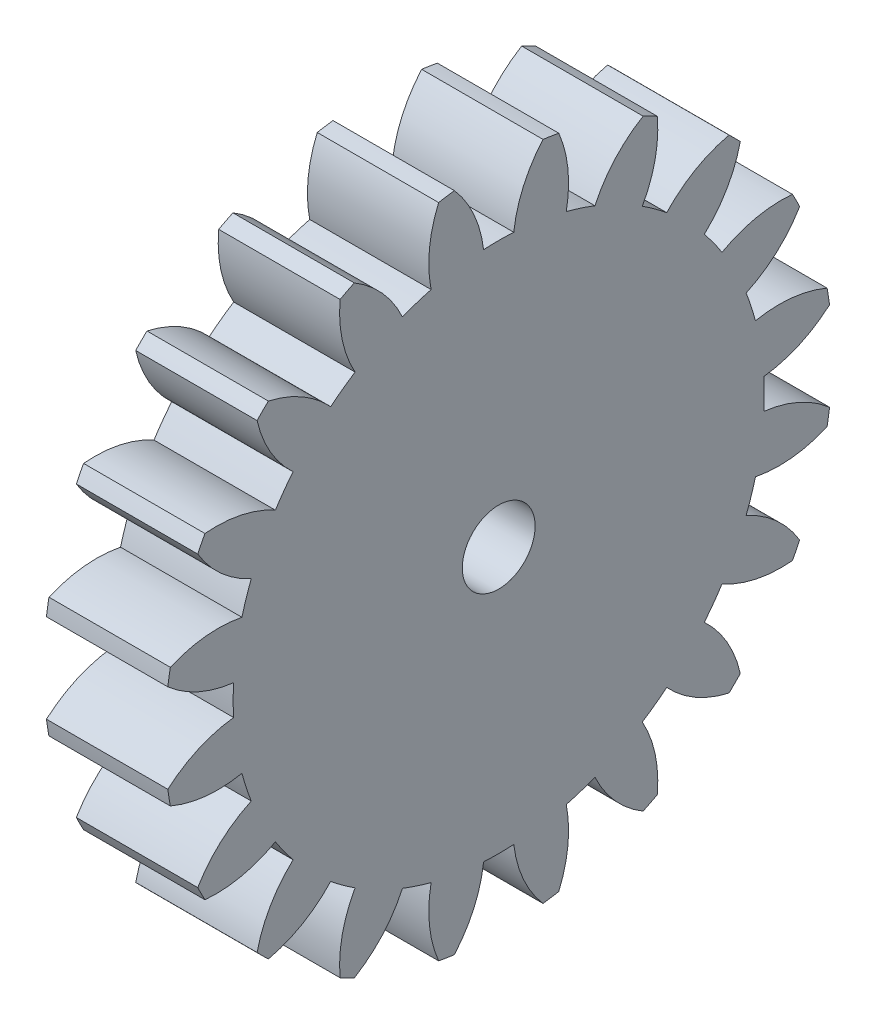
from build123d import *

# Parameters (mm, degrees)
BASPROSKE_W         = 12
BASPROSKE_H         = 13.75
TOOTHCUT_DEPTH      = 23.850054705
TEETHCUTS_COUNT     = 20
TEETHCUTS_ANGLE     = 342
BORSKE_R            = 1.5
BORE_DEPTH          = 50.0000508
SKETCH_1_R          = 18
CUT_EXTRUDE_1_DEPTH = 7


with BuildPart() as part:
    # BasProSke → Base-Revolve (revolve)
    with BuildSketch(Plane(origin=(0, 0, 0), x_dir=(1, 0, 0), z_dir=(0, 1, 0))):
        with Locations((6, 6.875)):
            Rectangle(BASPROSKE_W, BASPROSKE_H)
    revolve(axis=Axis((-10, 0, 0), (1, 0, 0)))

    # TooCutSke → ToothCut (cut, through all)
    with BuildSketch(Plane(origin=(0, 0, 0), x_dir=(0, 0, -1), z_dir=(1, 0, 0))):
        with BuildLine():
            ThreePointArc((0.62110296, 10.918848994), (0, 10.9365), (-0.62110296, 10.918848994))
            ThreePointArc((-0.62110296, 10.918848994), (-1.024517052, 12.378857135), (-1.846615859, 13.651067908))
            ThreePointArc((-1.846615859, 13.651067908), (0, 13.7754), (1.846615859, 13.651067908))
            ThreePointArc((1.846615859, 13.651067908), (1.024517052, 12.378857135), (0.62110296, 10.918848994))
        make_face()
    toothcut = extrude(amount=TOOTHCUT_DEPTH, mode=Mode.SUBTRACT)

    # TeethCuts: ToothCut ×20 about axis
    teethcuts_axis = Axis((-10, 0, 0), (1, 0, 0))
    for i in range(1, TEETHCUTS_COUNT):
        add(toothcut.rotate(teethcuts_axis, i * TEETHCUTS_ANGLE / (TEETHCUTS_COUNT - 1)), mode=Mode.SUBTRACT)

    # BorSke → Bore (cut, symmetric)
    with BuildSketch(Plane(origin=(0, 0, 0), x_dir=(0, 0, -1), z_dir=(1, 0, 0))):
        Circle(BORSKE_R)
    extrude(amount=BORE_DEPTH, both=True, mode=Mode.SUBTRACT)

    # 草圖1 → 除料-伸長1 (cut)
    with BuildSketch(Plane(origin=(12, 0, 0), x_dir=(0, 0, -1), z_dir=(1, 0, 0))):
        Circle(SKETCH_1_R)
    extrude(amount=-CUT_EXTRUDE_1_DEPTH, mode=Mode.SUBTRACT)


solid = part.part
